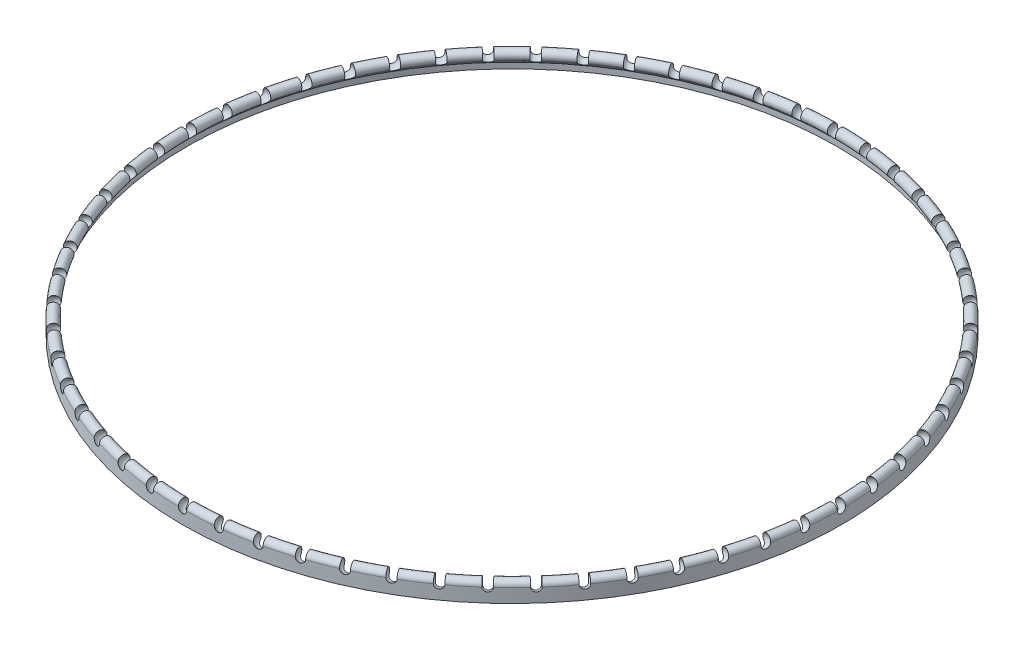
from build123d import *

# Parameters (mm, degrees)
CIRPATTERN1_COUNT = 60


with BuildPart() as part:
    # Sketch3 → Revolve5 (revolve)
    with BuildSketch(Plane.XY):
        with BuildLine():
            ThreePointArc((-110.762563133, -22.237436867), (-111.330303993, -19.383210818), (-113.75, -21))
            Line((-113.75, -21), (-113.75, -25.774873734))
            Line((-113.75, -25.774873734), (-112.3, -25.774873734))
            Line((-112.3, -25.774873734), (-112.3, -23.774873734))
            Line((-112.3, -23.774873734), (-110.762563133, -22.237436867))
        make_face()
    revolve(axis=Axis((0, 0, 0), (0, 1, 0)))

    # Sketch3<9> → Cut-Revolve1 (revolve, cut)
    with BuildSketch(Plane.XY):
        with BuildLine():
            Line((-112, -18.75), (-112, -23.25))
            ThreePointArc((-112, -23.25), (-109.75, -21), (-112, -18.75))
        make_face()
    cut_revolve1 = revolve(axis=Axis((-112, -18.100862197, 0), (0, -1, 0)), mode=Mode.SUBTRACT)

    # CirPattern1: Cut-Revolve1 ×60 about axis
    cirpattern1_axis = Axis((0, 0, 0), (0, 1, 0))
    for i in range(1, CIRPATTERN1_COUNT):
        add(cut_revolve1.rotate(cirpattern1_axis, i * 360 / CIRPATTERN1_COUNT), mode=Mode.SUBTRACT)


solid = part.part
